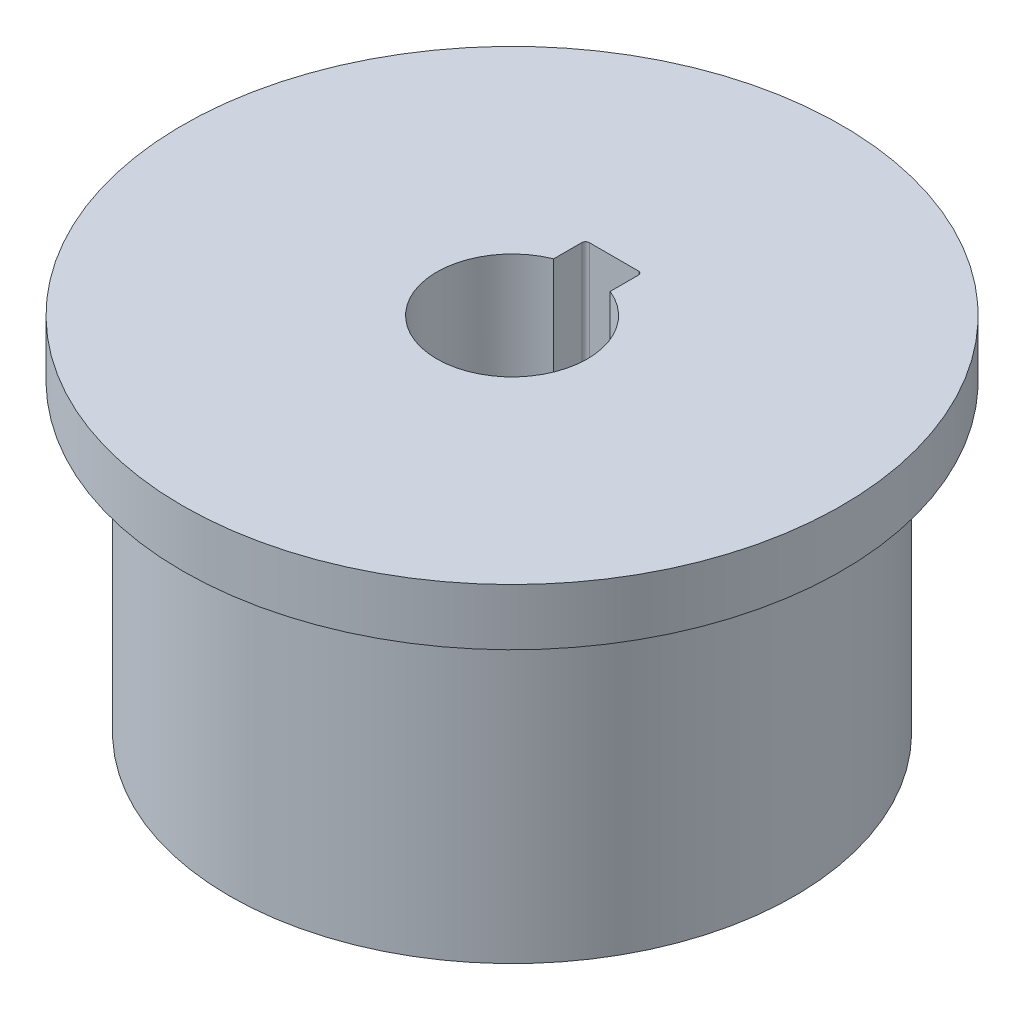
from build123d import *

# Parameters (mm, degrees)
ENL_V_MAT_EXTRU_1_DEPTH = 15
CONG_1_R                = 0.2


with BuildPart() as part:
    # Sketch1 → Revolve1 (revolve)
    with BuildSketch(Plane.XY):
        Polygon((4, 19.2), (17.5, 19.2), (17.5, 16.2), (15, 16.2), (15, 0), (12, 0), (12, 16.2), (8, 16.2), (8, -1), (5, -4), (4, -4), align=None)
    revolve(axis=Axis((0, 12.709342281, 0), (0, -1, 0)))

    # Esquisse1 → Enlèv. mat.-Extru.1 (cut)
    with BuildSketch(Plane(origin=(0, 19.2, 0), x_dir=(1, 0, 0), z_dir=(0, 1, 0))):
        with BuildLine():
            Line((-1.5, 5.4), (-1.5, 3.708099244))
            ThreePointArc((-1.5, 3.708099244), (0, 4), (1.5, 3.708099244))
            Line((1.5, 3.708099244), (1.5, 5.4))
            Line((1.5, 5.4), (-1.5, 5.4))
        make_face()
    extrude(amount=-ENL_V_MAT_EXTRU_1_DEPTH, mode=Mode.SUBTRACT)

    # Congé1
    cong_1_edges = [part.edges().sort_by_distance(p)[0] for p in [
        (1.5, 11.7, -5.4),
        (-1.5, 11.7, -5.4),
    ]]
    fillet(cong_1_edges, radius=CONG_1_R)


solid = part.part
